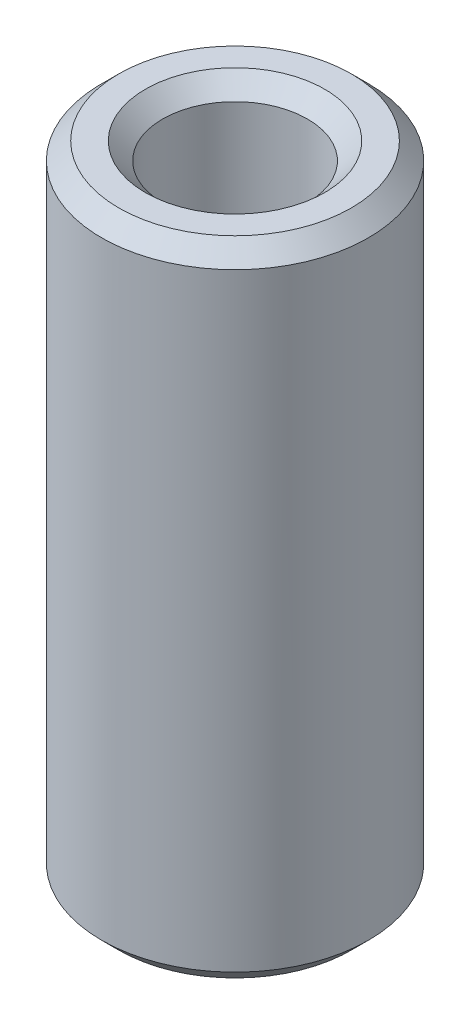
from build123d import *

# Parameters (mm, degrees)
SKETCH1_R           = 25
BOSS_EXTRUDE1_DEPTH = 120.422147291
SKETCH2_R           = 13.568683255
CUT_EXTRUDE1_DEPTH  = 126.504954317
CHAMFER1_SIZE       = 3.225296163


with BuildPart() as part:
    # Sketch1 → Boss-Extrude1 (new body)
    with BuildSketch(Plane(origin=(0, 0, 0), x_dir=(1, 0, 0), z_dir=(0, 1, 0))):
        Circle(SKETCH1_R)
    extrude(amount=BOSS_EXTRUDE1_DEPTH)

    # Sketch2 → Cut-Extrude1 (cut, through all)
    with BuildSketch(Plane(origin=(0, 0, 0), x_dir=(1, 0, 0), z_dir=(0, 1, 0))):
        Circle(SKETCH2_R)
    extrude(amount=CUT_EXTRUDE1_DEPTH, mode=Mode.SUBTRACT)

    # Chamfer1
    chamfer1_edges = [part.edges().sort_by_distance(p)[0] for p in [
        (-13.568683255, 120.422147291, 0),
        (-13.568683255, 0, 0),
        (-25, 0, 0),
        (-25, 120.422147291, 0),
    ]]
    chamfer(chamfer1_edges, length=CHAMFER1_SIZE)


solid = part.part
